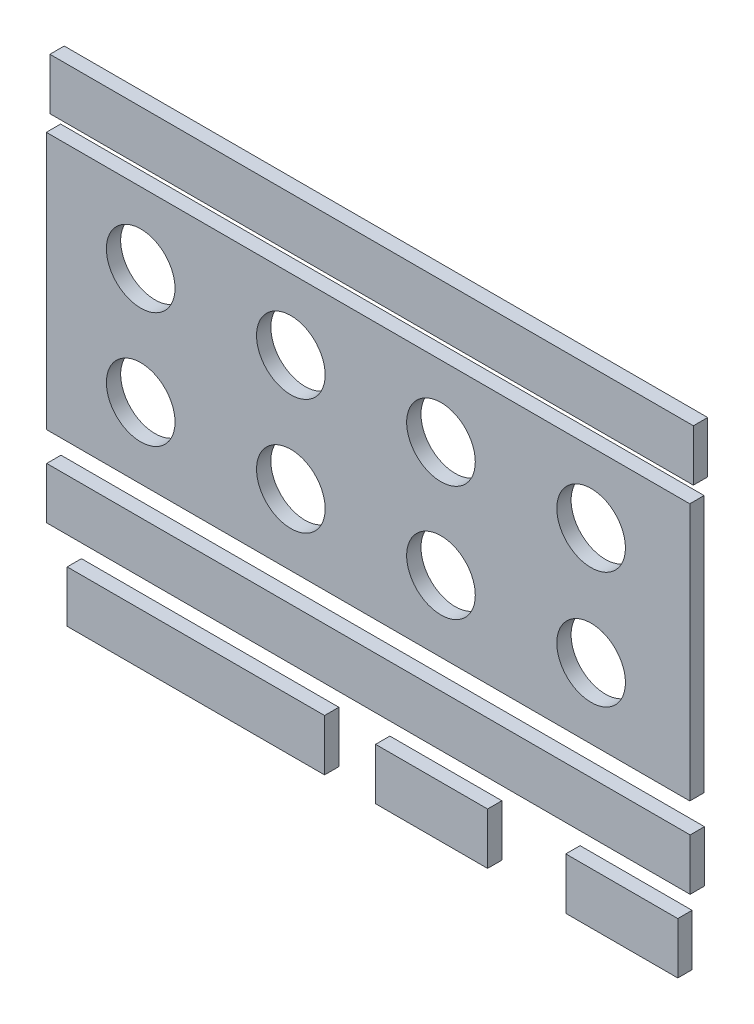
from build123d import *

# Parameters (mm, degrees)
MODEL_W               = 135
MODEL_H               = 54
MODEL_R               = 7.2
BOSS_EXTRUDE1_DEPTH   = 3
MODEL_W_2             = 54
MODEL_H_2             = 10.8
BOSS_EXTRUDE1_2_DEPTH = 3
BOSS_EXTRUDE1_3_DEPTH = 3
MODEL_W_3             = 23.5
BOSS_EXTRUDE1_4_DEPTH = 3
BOSS_EXTRUDE1_5_DEPTH = 3
BOSS_EXTRUDE1_6_DEPTH = 3
SCALE1_DEPTH          = 3
SCALE1_START          = -0.1665
SCALE1_2_OUTLINE_W    = 149.985
SCALE1_2_OUTLINE_H    = 59.994
SCALE1_2_OUTLINE_R    = 7.9992
SCALE1_2_DEPTH        = 3.333
SCALE1_START_2        = 446.653714964
SCALE1_3_OUTLINE_W    = 149.985
SCALE1_3_OUTLINE_H    = 3.333
SCALE1_3_DEPTH        = 11.9988
SCALE1_START_3        = 369.383026174
SCALE1_4_OUTLINE_W    = 26.1085
SCALE1_4_OUTLINE_H    = 3.333
SCALE1_4_DEPTH        = 11.9988
SCALE1_START_4        = 369.335990799
SCALE1_5_OUTLINE_W    = 26.1085
SCALE1_5_OUTLINE_H    = 3.333
SCALE1_5_DEPTH        = 11.9988
SCALE1_START_5        = 369.210927513
SCALE1_6_OUTLINE_W    = 59.994
SCALE1_6_OUTLINE_H    = 3.333
SCALE1_6_DEPTH        = 11.9988
SCALE1_START_6        = 380.646561708
SCALE1_7_OUTLINE_W    = 149.985
SCALE1_7_OUTLINE_H    = 3.333
SCALE1_7_DEPTH        = 11.9988


# Read off the part's stored shape, not the designer's step: Scale1
with BuildPart() as part:
    # Model → Boss-Extrude1 (new body)
    with BuildSketch(Plane.XY):
        with Locations((70.521412424, 419.624764679)):
            Rectangle(MODEL_W, MODEL_H)
        with Locations((117.321412424, 431.864764679)):
            Circle(MODEL_R, mode=Mode.SUBTRACT)
        with Locations((54.321733854, 407.474764679)):
            Circle(MODEL_R, mode=Mode.SUBTRACT)
        with Locations((22.821733854, 431.774764679)):
            Circle(MODEL_R, mode=Mode.SUBTRACT)
        with Locations((22.821733854, 407.474764679)):
            Circle(MODEL_R, mode=Mode.SUBTRACT)
        with Locations((117.321412424, 407.384764679)):
            Circle(MODEL_R, mode=Mode.SUBTRACT)
        with Locations((85.821701711, 431.729764679)):
            Circle(MODEL_R, mode=Mode.SUBTRACT)
        with Locations((85.821701711, 407.519764679)):
            Circle(MODEL_R, mode=Mode.SUBTRACT)
        with Locations((54.321733854, 431.774764679)):
            Circle(MODEL_R, mode=Mode.SUBTRACT)
    extrude(amount=BOSS_EXTRUDE1_DEPTH)

    # Scale1 outline → Scale1 (cut)
    with BuildSketch(Plane.XY):
        with BuildLine():
            ThreePointArc((120.599852685, 425.454473776), (130.243207193, 435.251393662), (117.034279248, 439.059037022))
            ThreePointArc((117.034279248, 439.059037022), (124.286181967, 433.690137301), (120.599852685, 425.454473776))
        make_face()
        with BuildLine():
            ThreePointArc((59.775926661, 402.774575233), (48.549318786, 403.171367849), (51.374507231, 414.04392408))
            ThreePointArc((51.374507231, 414.04392408), (46.099552197, 401.3450408), (59.775926661, 402.774575233))
        make_face()
        with BuildLine():
            ThreePointArc((19.516367614, 425.378316132), (15.843653478, 433.548572523), (22.972146088, 438.973193408))
            ThreePointArc((22.972146088, 438.973193408), (9.76355804, 435.094115194), (19.516367614, 425.378316132))
        make_face()
        with BuildLine():
            ThreePointArc((22.972146088, 400.27633595), (15.843653478, 405.700956835), (19.516367614, 413.871213226))
            ThreePointArc((19.516367614, 413.871213226), (9.76355804, 404.155414164), (22.972146088, 400.27633595))
        make_face()
        with BuildLine():
            ThreePointArc((117.034279248, 400.190492336), (130.243207193, 403.998135696), (120.599852685, 413.795055582))
            ThreePointArc((120.599852685, 413.795055582), (124.286181967, 405.559392057), (117.034279248, 400.190492336))
        make_face()
        with BuildLine():
            ThreePointArc((88.815187829, 425.181555698), (93.766910466, 438.056177976), (80.110310207, 436.11382753))
            ThreePointArc((80.110310207, 436.11382753), (91.454231718, 436.21469564), (88.815187829, 425.181555698))
        make_face()
        with BuildLine():
            ThreePointArc((80.110310207, 403.135701828), (93.766910466, 401.193351382), (88.815187829, 414.06797366))
            ThreePointArc((88.815187829, 414.06797366), (91.454231718, 403.034833718), (80.110310207, 403.135701828))
        make_face()
        with BuildLine():
            ThreePointArc((51.374507231, 425.205605278), (48.549318786, 436.078161509), (59.775926661, 436.474954125))
            ThreePointArc((59.775926661, 436.474954125), (46.099552197, 437.904488558), (51.374507231, 425.205605278))
        make_face()
    extrude(amount=SCALE1_DEPTH, mode=Mode.SUBTRACT)

    # Scale1 2 outline → Scale1 2 (add)
    with BuildSketch(Plane.XY.offset(SCALE1_START)):
        with Locations((70.51054823, 419.624764679)):
            Rectangle(SCALE1_2_OUTLINE_W, SCALE1_2_OUTLINE_H)
        with Locations((87.509169628, 433.073419679)):
            Circle(SCALE1_2_OUTLINE_R, mode=Mode.SUBTRACT)
        with Locations((122.50534823, 433.223404679)):
            Circle(SCALE1_2_OUTLINE_R, mode=Mode.SUBTRACT)
        with Locations((17.516205338, 406.126114679)):
            Circle(SCALE1_2_OUTLINE_R, mode=Mode.SUBTRACT)
        with Locations((52.512705338, 406.126114679)):
            Circle(SCALE1_2_OUTLINE_R, mode=Mode.SUBTRACT)
        with Locations((87.509169628, 406.176109679)):
            Circle(SCALE1_2_OUTLINE_R, mode=Mode.SUBTRACT)
        with Locations((122.50534823, 406.026124679)):
            Circle(SCALE1_2_OUTLINE_R, mode=Mode.SUBTRACT)
        with Locations((17.516205338, 433.123414679)):
            Circle(SCALE1_2_OUTLINE_R, mode=Mode.SUBTRACT)
        with Locations((52.512705338, 433.123414679)):
            Circle(SCALE1_2_OUTLINE_R, mode=Mode.SUBTRACT)
    extrude(amount=SCALE1_2_DEPTH)


with BuildPart() as body_2:
    # Model → Boss-Extrude1 2 (new body)
    with BuildSketch(Plane.XY):
        with Locations((30.375615719, 375.210327513)):
            Rectangle(MODEL_W_2, MODEL_H_2)
    extrude(amount=BOSS_EXTRUDE1_2_DEPTH)

    # Scale1 6 outline → Scale1 6 (add)
    with BuildSketch(Plane(origin=(0, 0, 0), x_dir=(1, 0, 0), z_dir=(0, 1, 0)).offset(SCALE1_START_5)):
        with Locations((30.375615719, -1.5)):
            Rectangle(SCALE1_6_OUTLINE_W, SCALE1_6_OUTLINE_H)
    extrude(amount=SCALE1_6_DEPTH)


with BuildPart() as body_3:
    # Model → Boss-Extrude1 3 (new body)
    with BuildSketch(Plane.XY):
        with Locations((70.593048587, 386.645961708)):
            Rectangle(MODEL_W, MODEL_H_2)
    extrude(amount=BOSS_EXTRUDE1_3_DEPTH)

    # Scale1 7 outline → Scale1 7 (add)
    with BuildSketch(Plane(origin=(0, 0, 0), x_dir=(1, 0, 0), z_dir=(0, 1, 0)).offset(SCALE1_START_6)):
        with Locations((70.593048587, -1.5)):
            Rectangle(SCALE1_7_OUTLINE_W, SCALE1_7_OUTLINE_H)
    extrude(amount=SCALE1_7_DEPTH)


with BuildPart() as body_4:
    # Model → Boss-Extrude1 4 (new body)
    with BuildSketch(Plane.XY):
        with Locations((94.586456263, 375.382426174)):
            Rectangle(MODEL_W_3, MODEL_H_2)
    extrude(amount=BOSS_EXTRUDE1_4_DEPTH)

    # Scale1 4 outline → Scale1 4 (add)
    with BuildSketch(Plane(origin=(0, 0, 0), x_dir=(1, 0, 0), z_dir=(0, 1, 0)).offset(SCALE1_START_3)):
        with Locations((94.586456263, -1.5)):
            Rectangle(SCALE1_4_OUTLINE_W, SCALE1_4_OUTLINE_H)
    extrude(amount=SCALE1_4_DEPTH)


with BuildPart() as body_5:
    # Model → Boss-Extrude1 5 (new body)
    with BuildSketch(Plane.XY):
        with Locations((71.349818497, 452.653114964)):
            Rectangle(MODEL_W, MODEL_H_2)
    extrude(amount=BOSS_EXTRUDE1_5_DEPTH)

    # Scale1 3 outline → Scale1 3 (add)
    with BuildSketch(Plane(origin=(0, 0, 0), x_dir=(1, 0, 0), z_dir=(0, 1, 0)).offset(SCALE1_START_2)):
        with Locations((71.349818497, -1.5)):
            Rectangle(SCALE1_3_OUTLINE_W, SCALE1_3_OUTLINE_H)
    extrude(amount=SCALE1_3_DEPTH)


with BuildPart() as body_6:
    # Model → Boss-Extrude1 6 (new body)
    with BuildSketch(Plane.XY):
        with Locations((70.178845551, 375.335390799)):
            Rectangle(MODEL_W_3, MODEL_H_2)
    extrude(amount=BOSS_EXTRUDE1_6_DEPTH)

    # Scale1 5 outline → Scale1 5 (add)
    with BuildSketch(Plane(origin=(0, 0, 0), x_dir=(1, 0, 0), z_dir=(0, 1, 0)).offset(SCALE1_START_4)):
        with Locations((70.178845551, -1.5)):
            Rectangle(SCALE1_5_OUTLINE_W, SCALE1_5_OUTLINE_H)
    extrude(amount=SCALE1_5_DEPTH)


with BuildPart() as body_3_1:
    # Body-Move/Copy1: moved
    add(body_3.part.moved(Location((0, -9.825424502, 0))))


with BuildPart() as body_2_1:
    # Body-Move/Copy1: moved
    add(body_2.part.moved(Location((0, -9.825424502, 0))))


with BuildPart() as body_6_1:
    # Body-Move/Copy1: moved
    add(body_6.part.moved(Location((0, -9.825424502, 0))))


with BuildPart() as body_4_1:
    # Body-Move/Copy1: moved
    add(body_4.part.moved(Location((0, -9.825424502, 0))))


with BuildPart() as body_2_2:
    # Body-Move/Copy3: moved
    add(body_2_1.part.moved(Location((0, -7.061484852, 0))))


with BuildPart() as body_6_2:
    # Body-Move/Copy3: moved
    add(body_6_1.part.moved(Location((0, -7.061484852, 0))))


with BuildPart() as body_4_2:
    # Body-Move/Copy3: moved
    add(body_4_1.part.moved(Location((0, -7.061484852, 0))))


with BuildPart() as body_4_3:
    # Body-Move/Copy4: moved
    add(body_4_2.part.moved(Location((35.063669181, 0, 0))))


with BuildPart() as body_6_3:
    # Body-Move/Copy5: moved
    add(body_6_2.part.moved(Location((15.135881893, 0, 0))))


with BuildPart() as body_5_1:
    # Body-Move/Copy6: moved
    add(body_5.part.moved(Location((0, 7.140723713, 0))))


solid = Compound([part.part, body_3_1.part, body_2_2.part, body_4_3.part, body_6_3.part, body_5_1.part])
